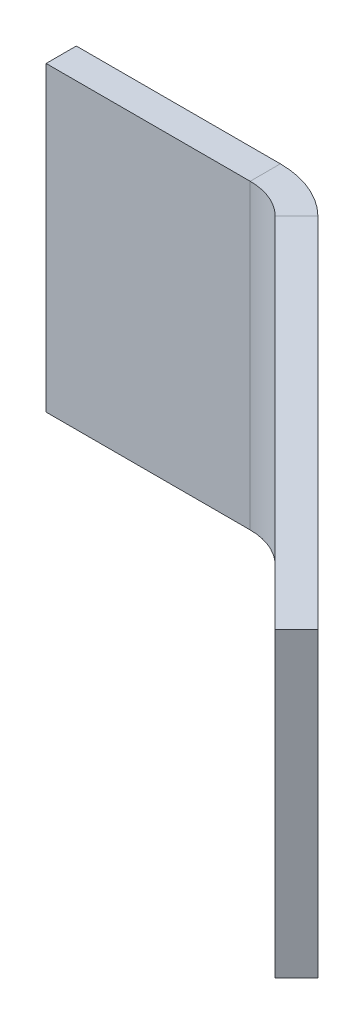
from build123d import *

# Parameters (mm, degrees)
BASE_FLANGE1_DEPTH = 10
SKETCH4_R          = 1.5
CUT_EXTRUDE1_DEPTH = 27.149638759


# Sheet-metal steps are written as plain solids
with BuildPart() as part:
    # Sketch1 → Base-Flange1 (new body)
    with BuildSketch(Plane(origin=(0, 0, 0), x_dir=(1, 0, 0), z_dir=(0, 1, 0))):
        with BuildLine():
            Line((0, 0), (6.757359313, 0))
            ThreePointArc((6.757359313, 0), (7.90540961, -0.228361402), (8.878679656, -0.878679656))
            Line((8.878679656, -0.878679656), (20.727922061, -12.727922061))
            Line((20.727922061, -12.727922061), (20.02081528, -13.435028843))
            Line((20.02081528, -13.435028843), (8.171572875, -1.585786438))
            ThreePointArc((8.171572875, -1.585786438), (7.522726178, -1.152240935), (6.757359313, -1))
            Line((6.757359313, -1), (0, -1))
            Line((0, -1), (0, 0))
        make_face()
    extrude(amount=BASE_FLANGE1_DEPTH)

    # Sketch4 → Cut-Extrude1 (cut, through all)
    with BuildSketch(Plane(origin=(3.292893219, 0, -3.292893219), x_dir=(0.7071067811865465, 0, 0.7071067811865486), z_dir=(-0.7071067811865486, 0, 0.7071067811865465))):
        with Locations((19.656854249, 5)):
            Circle(SKETCH4_R)
    extrude(amount=-CUT_EXTRUDE1_DEPTH, mode=Mode.SUBTRACT)


solid = part.part
